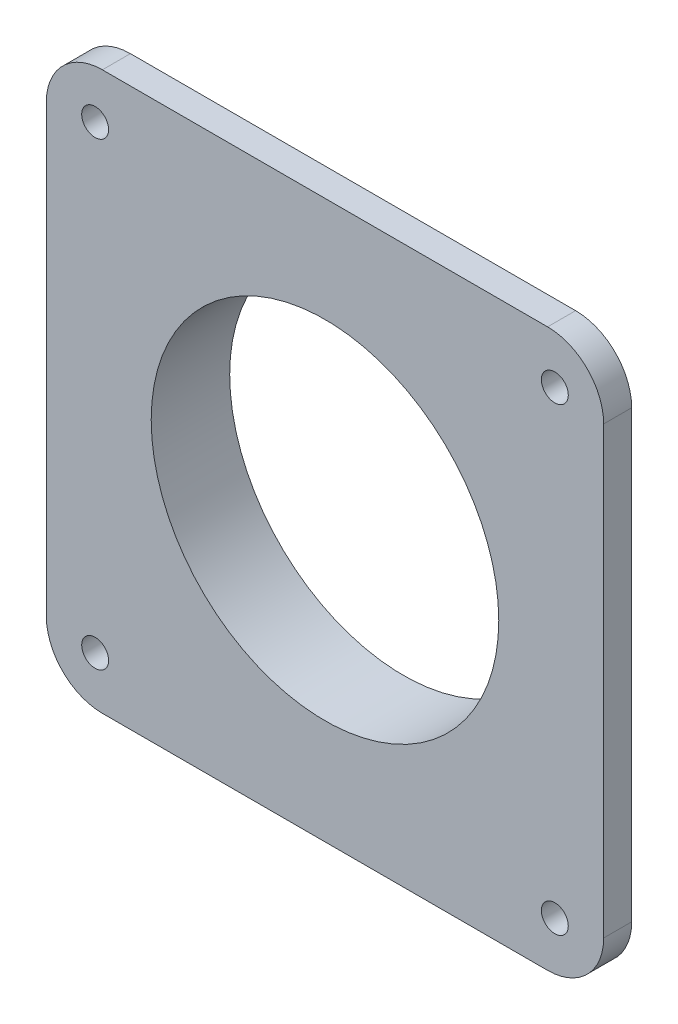
from build123d import *
from build123d.topology import SkipClean

# Parameters (mm, degrees)
SKETCH2_W           = 99.415080592
SKETCH2_H           = 99.415080592
SKETCH2_R           = 2.4
SKETCH2_R_2         = 31
BOSS_EXTRUDE1_DEPTH = 10
SKETCH4_R           = 81.568467367
CUT_EXTRUDE1_DEPTH  = 5
FILLET1_R           = 10
BOSS_EXTRUDE3_START = 9
SKETCH5_R           = 35.16778574
SKETCH5_R_2         = 31
BOSS_EXTRUDE3_DEPTH = 9
FILLET2_R           = 10


with BuildPart() as part:
    # Sketch2 → Boss-Extrude1 (new body)
    with BuildSketch(Plane.XY):
        Rectangle(SKETCH2_W, SKETCH2_H)
        with Locations((-41, 41)):
            Circle(SKETCH2_R, mode=Mode.SUBTRACT)
        with Locations((41, 41)):
            Circle(SKETCH2_R, mode=Mode.SUBTRACT)
        with Locations((41, -41)):
            Circle(SKETCH2_R, mode=Mode.SUBTRACT)
        with Locations((-41, -41)):
            Circle(SKETCH2_R, mode=Mode.SUBTRACT)
        Circle(SKETCH2_R_2, mode=Mode.SUBTRACT)
    extrude(amount=BOSS_EXTRUDE1_DEPTH)

    # Sketch4 → Cut-Extrude1 (cut)
    with BuildSketch(Plane(origin=(0, 0, 0), x_dir=(-1, 0, 0), z_dir=(0, 0, -1))):
        Circle(SKETCH4_R)
    extrude(amount=-CUT_EXTRUDE1_DEPTH, mode=Mode.SUBTRACT)

    # Fillet1
    fillet1_edges = [part.edges().sort_by_distance(p)[0] for p in [
        (-49.707540296, 49.707540296, 7.5),
        (49.707540296, 49.707540296, 7.5),
        (49.707540296, -49.707540296, 7.5),
        (-49.707540296, -49.707540296, 7.5),
    ]]
    fillet(fillet1_edges, radius=FILLET1_R)

    # Sketch5 → Boss-Extrude3 (add)
    with SkipClean():  # the faces are left unmerged after this step: merging them gives an invalid solid
        with BuildSketch(Plane(origin=(0, 0, 5), x_dir=(-1, 0, 0), z_dir=(0, 0, -1)).offset(BOSS_EXTRUDE3_START)):
            Circle(SKETCH5_R)
            Circle(SKETCH5_R_2, mode=Mode.SUBTRACT)
        extrude(amount=-BOSS_EXTRUDE3_DEPTH)

    # Fillet2
    # the kernel refuses this fillet: 10 mm, written as the material it adds along each edge
    with BuildSketch(Plane(origin=(0, 0, 5), x_dir=(-1, 0, 0), z_dir=(0, -1, 0))) as fillet2_piece_1:
        with BuildLine():
            CenterArc((45.117660111, 10), FILLET2_R, 185.739170477, 84.260829523)
            Line((35.16778574, 9), (34.968788253, 8.98))
            ThreePointArc((34.968788253, 8.98), (34.96778574, 4.5), (34.96778574, 0))
            Line((34.96778574, 0), (35.16778574, -0.2))
            Line((35.16778574, -0.2), (45.117660111, -0.2))
            Line((45.117660111, -0.2), (45.117660111, 0))
        make_face()
    revolve(axis=Axis((0, 0, 5), (0, 0, -1)))


solid = part.part
